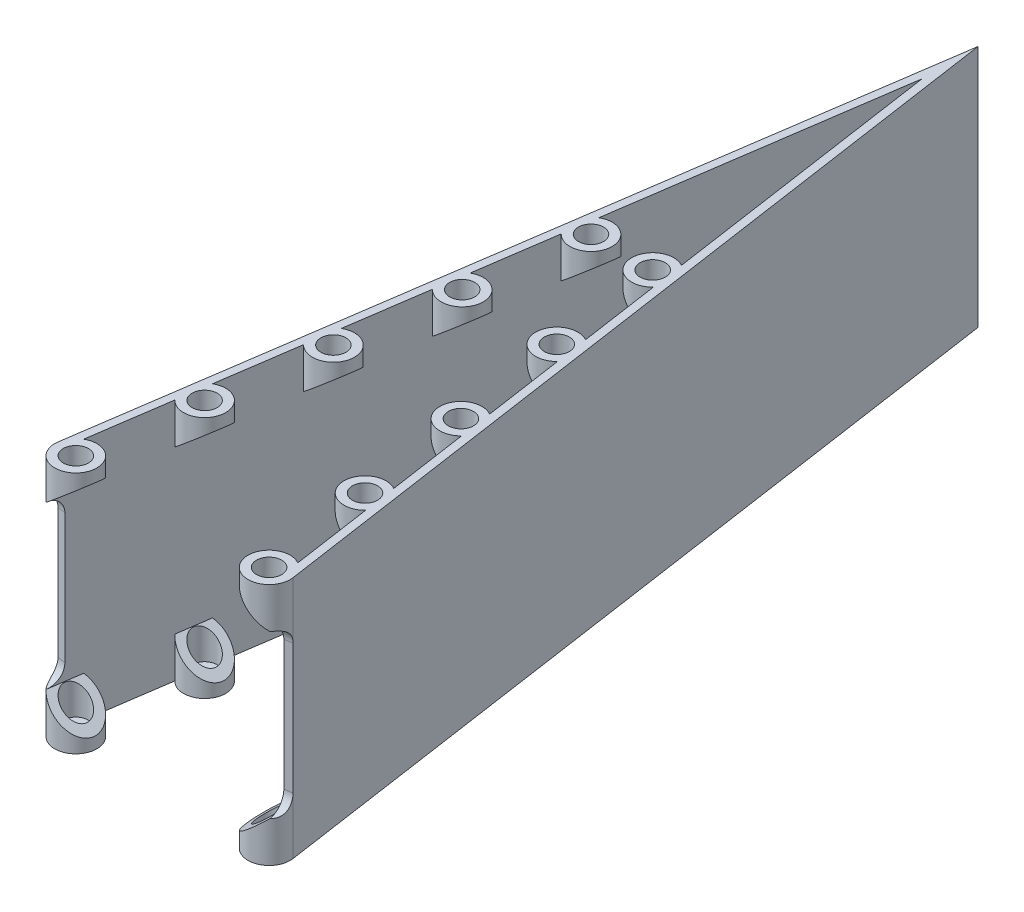
from build123d import *

# Parameters (mm, degrees)
BOSS_EXTRUDE1_DEPTH            = 30
SKETCH2_R                      = 2.6
SKETCH2_R_2                    = 1.55
BOSS_EXTRUDE3_DEPTH            = 5
CUT_EXTRUDE1_REACH             = 108.419
CUT_EXTRUDE1_DIRECTION_2_DEPTH = 107.419489108
CUT_EXTRUDE2_REACH             = 108.419
CUT_EXTRUDE2_DIRECTION_2_DEPTH = 107.419489108
FILLET1_R                      = 2
SKETCH6_R                      = 1.55
BOSS_EXTRUDE4_DEPTH            = 1


with BuildPart() as part:
    # Sketch1 → Boss-Extrude1 (new body)
    with BuildSketch(Plane(origin=(0, 0, 0), x_dir=(1, 0, 0), z_dir=(0, 1, 0))):
        Polygon((-13.5, 0), (0, 92.188031325), (13.5, 0), (14.489447114, 0.144894471), (0, 99.089605913), (-14.489447114, 0.144894471), align=None)
    extrude(amount=BOSS_EXTRUDE1_DEPTH)

    # Sketch2 → Boss-Extrude3 (add)
    # profile 1 of 10: a face of its own
    with BuildSketch(Plane(origin=(0, 0, 0), x_dir=(1, 0, 0), z_dir=(0, 1, 0))):
        with Locations((11.916884617, -0.231831154)):
            Circle(SKETCH2_R)
        with Locations(Location((11.916884617, -0.231831154, 0), (0, 0, 270))):
            Circle(SKETCH2_R_2, mode=Mode.SUBTRACT)
    # profile 2 of 10: a face of its own
    with BuildSketch(Plane(origin=(0, 0, 0), x_dir=(1, 0, 0), z_dir=(0, 1, 0))):
        with Locations((9.888362021, 13.620428448)):
            Circle(SKETCH2_R)
        with Locations(Location((9.888362021, 13.620428448, 0), (0, 0, 270))):
            Circle(SKETCH2_R_2, mode=Mode.SUBTRACT)
    # profile 3 of 10: a face of its own
    with BuildSketch(Plane(origin=(0, 0, 0), x_dir=(1, 0, 0), z_dir=(0, 1, 0))):
        with Locations((7.859839425, 27.47268805)):
            Circle(SKETCH2_R)
        with Locations(Location((7.859839425, 27.47268805, 0), (0, 0, 270))):
            Circle(SKETCH2_R_2, mode=Mode.SUBTRACT)
    # profile 4 of 10: a face of its own
    with BuildSketch(Plane(origin=(0, 0, 0), x_dir=(1, 0, 0), z_dir=(0, 1, 0))):
        with Locations((5.831316829, 41.324947652)):
            Circle(SKETCH2_R)
        with Locations(Location((5.831316829, 41.324947652, 0), (0, 0, 270))):
            Circle(SKETCH2_R_2, mode=Mode.SUBTRACT)
    # profile 5 of 10: a face of its own
    with BuildSketch(Plane(origin=(0, 0, 0), x_dir=(1, 0, 0), z_dir=(0, 1, 0))):
        with Locations((3.802794233, 55.177207254)):
            Circle(SKETCH2_R)
        with Locations(Location((3.802794233, 55.177207254, 0), (0, 0, 270))):
            Circle(SKETCH2_R_2, mode=Mode.SUBTRACT)
    # profile 6 of 10: a face of its own
    with BuildSketch(Plane(origin=(0, 0, 0), x_dir=(1, 0, 0), z_dir=(0, 1, 0))):
        with Locations((-11.916884617, -0.231831154)):
            Circle(SKETCH2_R)
        with Locations(Location((-11.916884617, -0.231831154, 0), (0, 0, 90))):
            Circle(SKETCH2_R_2, mode=Mode.SUBTRACT)
    # profile 7 of 10: a face of its own
    with BuildSketch(Plane(origin=(0, 0, 0), x_dir=(1, 0, 0), z_dir=(0, 1, 0))):
        with Locations((-9.888362021, 13.620428448)):
            Circle(SKETCH2_R)
        with Locations(Location((-9.888362021, 13.620428448, 0), (0, 0, 90))):
            Circle(SKETCH2_R_2, mode=Mode.SUBTRACT)
    # profile 8 of 10: a face of its own
    with BuildSketch(Plane(origin=(0, 0, 0), x_dir=(1, 0, 0), z_dir=(0, 1, 0))):
        with Locations((-7.859839425, 27.47268805)):
            Circle(SKETCH2_R)
        with Locations(Location((-7.859839425, 27.47268805, 0), (0, 0, 90))):
            Circle(SKETCH2_R_2, mode=Mode.SUBTRACT)
    # profile 9 of 10: a face of its own
    with BuildSketch(Plane(origin=(0, 0, 0), x_dir=(1, 0, 0), z_dir=(0, 1, 0))):
        with Locations((-5.831316829, 41.324947652)):
            Circle(SKETCH2_R)
        with Locations(Location((-5.831316829, 41.324947652, 0), (0, 0, 90))):
            Circle(SKETCH2_R_2, mode=Mode.SUBTRACT)
    # profile 10 of 10: a face of its own
    with BuildSketch(Plane(origin=(0, 0, 0), x_dir=(1, 0, 0), z_dir=(0, 1, 0))):
        with Locations((-3.802794233, 55.177207254)):
            Circle(SKETCH2_R)
        with Locations(Location((-3.802794233, 55.177207254, 0), (0, 0, 90))):
            Circle(SKETCH2_R_2, mode=Mode.SUBTRACT)
    boss_extrude3 = extrude(amount=BOSS_EXTRUDE3_DEPTH)

    # Cut-Extrude1: up to this face of the body (flat: up to its plane)
    cut_extrude1_end = Plane(part.part.faces().sort_by_distance((-6.674060715, 15.426495801, -46.612585527))[0])
    # Sketch4 → Cut-Extrude1 (cut, up to the picked face)
    with BuildSketch(Plane(origin=(0.283424505, 0, 1.935433121), x_dir=(0.9894471144188783, 0, -0.14489447114419254), z_dir=(0.14489447114419252, 0, 0.9894471144188782)), mode=Mode.PRIVATE) as cut_extrude1_sk1:
        Polygon((13.357536045, 5), (9.157536045, 5), (9.157536045, 1.475781549), align=None)
    cut_extrude1_tool1 = split(extrude(cut_extrude1_sk1.sketch, amount=-CUT_EXTRUDE1_REACH, mode=Mode.PRIVATE), bisect_by=cut_extrude1_end, keep=Keep.BOTH, mode=Mode.PRIVATE)
    cut_extrude1 = cut_extrude1_tool1.solids().sort_by(Axis((10.729548, 3.825261, 0.405705), (-0.14489447114419252, 0, -0.9894471144188782)))[0]
    add(cut_extrude1, mode=Mode.SUBTRACT)

    # Sketch4 → Cut-Extrude1 direction 2 (cut)
    with BuildSketch(Plane(origin=(0.283424505, 0, 1.935433121), x_dir=(0.9894471144188783, 0, -0.14489447114419254), z_dir=(0.14489447114419252, 0, 0.9894471144188782))):
        Polygon((13.357536045, 5), (9.157536045, 5), (9.157536045, 1.475781549), align=None)
    cut_extrude1_direction_2 = extrude(amount=CUT_EXTRUDE1_DIRECTION_2_DEPTH, mode=Mode.SUBTRACT)

    # Cut-Extrude2: up to this face of the body (flat: up to its plane)
    cut_extrude2_end = Plane(part.part.faces().sort_by_distance((6.674060715, 15.426495801, -46.612585527))[0])
    # Sketch5 → Cut-Extrude2 (cut, up to the picked face)
    with BuildSketch(Plane(origin=(-0.283424505, 0, 1.935433121), x_dir=(0.9894471144188784, 0, 0.14489447114419146), z_dir=(-0.14489447114419146, 0, 0.9894471144188784)), mode=Mode.PRIVATE) as cut_extrude2_sk1:
        Polygon((-9.157536045, 5), (-9.157536045, 1.475781549), (-13.357536045, 5), align=None)
    cut_extrude2_tool1 = split(extrude(cut_extrude2_sk1.sketch, amount=-CUT_EXTRUDE2_REACH, mode=Mode.PRIVATE), bisect_by=cut_extrude2_end, keep=Keep.BOTH, mode=Mode.PRIVATE)
    cut_extrude2 = cut_extrude2_tool1.solids().sort_by(Axis((-10.729548, 3.825261, 0.405705), (0.14489447114419146, 0, -0.9894471144188784)))[0]
    add(cut_extrude2, mode=Mode.SUBTRACT)

    # Sketch5 → Cut-Extrude2 direction 2 (cut)
    with BuildSketch(Plane(origin=(-0.283424505, 0, 1.935433121), x_dir=(0.9894471144188784, 0, 0.14489447114419146), z_dir=(-0.14489447114419146, 0, 0.9894471144188784))):
        Polygon((-9.157536045, 5), (-9.157536045, 1.475781549), (-13.357536045, 5), align=None)
    cut_extrude2_direction_2 = extrude(amount=CUT_EXTRUDE2_DIRECTION_2_DEPTH, mode=Mode.SUBTRACT)

    # Mirror2: Boss-Extrude3, Cut-Extrude1, Cut-Extrude1 direction 2, Cut-Extrude2, Cut-Extrude2 direction 2 across plane
    add(boss_extrude3.mirror(Plane.ZX.offset(15)))
    add(cut_extrude1.mirror(Plane.ZX.offset(15)), mode=Mode.SUBTRACT)
    add(cut_extrude1_direction_2.mirror(Plane.ZX.offset(15)), mode=Mode.SUBTRACT)
    add(cut_extrude2.mirror(Plane.ZX.offset(15)), mode=Mode.SUBTRACT)
    add(cut_extrude2_direction_2.mirror(Plane.ZX.offset(15)), mode=Mode.SUBTRACT)

    # Fillet1
    # the kernel refuses this fillet: 2 mm, written as the material it adds along each edge
    with BuildSketch(Plane(origin=(13.5, 5, 0), x_dir=(0, 1, 0), z_dir=(0.9894471144188783, 0, -0.1448944711441925))) as fillet1_piece_1_section:
        with BuildLine():
            CenterArc((FILLET1_R, FILLET1_R), FILLET1_R, 180, 90)
            Line((0, FILLET1_R), (0, 0))
            Line((0, 0), (FILLET1_R, 0))
        make_face()
    fillet1_piece_1 = extrude(amount=6, mode=Mode.PRIVATE)
    fillet1_piece_1 = fillet1_piece_1 & Plane(origin=(11.916884617, 5.699977741, 0.231831154), x_dir=(1, 0, 0), z_dir=(0, -1, 0)) * Cylinder(2.6, 20, mode=Mode.PRIVATE)
    add(fillet1_piece_1)
    with BuildSketch(Plane(origin=(13.5, 25, 0), x_dir=(0, -1, 0), z_dir=(0.9894471144188783, 0, -0.1448944711441925))) as fillet1_piece_2_section:
        with BuildLine():
            CenterArc((FILLET1_R, -FILLET1_R), FILLET1_R, 90, 90)
            Line((0, -FILLET1_R), (0, 0))
            Line((0, 0), (FILLET1_R, 0))
        make_face()
    fillet1_piece_2 = extrude(amount=6, mode=Mode.PRIVATE)
    fillet1_piece_2 = fillet1_piece_2 & Plane(origin=(11.916884617, 24.30002226, 0.231831154), x_dir=(1, 0, 0), z_dir=(0, 1, 0)) * Cylinder(2.6, 20, mode=Mode.PRIVATE)
    add(fillet1_piece_2)
    with BuildSketch(Plane(origin=(-19.436682687, 25, -0.869366827), x_dir=(0, -1, 0), z_dir=(0.9894471144188784, 0, 0.1448944711441914))) as fillet1_piece_3_section:
        with BuildLine():
            CenterArc((FILLET1_R, -FILLET1_R), FILLET1_R, 90, 90)
            Line((0, -FILLET1_R), (0, 0))
            Line((0, 0), (FILLET1_R, 0))
        make_face()
    fillet1_piece_3 = extrude(amount=6, mode=Mode.PRIVATE)
    fillet1_piece_3 = fillet1_piece_3 & Plane(origin=(-11.916884617, 24.777637105, 0.231831154), x_dir=(1, 0, 0), z_dir=(0, 1, 0)) * Cylinder(2.6, 21, mode=Mode.PRIVATE)
    add(fillet1_piece_3)
    with BuildSketch(Plane(origin=(-19.436682687, 5, -0.869366827), x_dir=(-0.1448944711441914, 0, 0.9894471144188784), z_dir=(0.9894471144188784, 0, 0.1448944711441914))) as fillet1_piece_4_section:
        with BuildLine():
            CenterArc((FILLET1_R, -FILLET1_R), FILLET1_R, 90, 90)
            Line((0, -FILLET1_R), (0, 0))
            Line((0, 0), (FILLET1_R, 0))
        make_face()
    fillet1_piece_4 = extrude(amount=6, mode=Mode.PRIVATE)
    fillet1_piece_4 = fillet1_piece_4 & Plane(origin=(-11.916884617, 5.222362792, 0.231831154), x_dir=(1, 0, 0), z_dir=(0, -1, 0)) * Cylinder(2.6, 21, mode=Mode.PRIVATE)
    add(fillet1_piece_4)

    # Sketch6 → Boss-Extrude4 (add)
    with BuildSketch(Plane.XZ):
        with Locations(Location((3.802794233, -55.177207254, 0), (0, 0, 270))):
            Circle(SKETCH6_R)
        with Locations(Location((-3.802794233, -55.177207254, 0), (0, 0, 270))):
            Circle(SKETCH6_R)
        with Locations(Location((-5.831316829, -41.324947652, 0), (0, 0, 270))):
            Circle(SKETCH6_R)
        with Locations(Location((5.831316829, -41.324947652, 0), (0, 0, 270))):
            Circle(SKETCH6_R)
        with Locations(Location((7.859839425, -27.47268805, 0), (0, 0, 270))):
            Circle(SKETCH6_R)
        with Locations(Location((-7.859839425, -27.47268805, 0), (0, 0, 270))):
            Circle(SKETCH6_R)
        with Locations(Location((-9.888362021, -13.620428448, 0), (0, 0, 270))):
            Circle(SKETCH6_R)
        with Locations(Location((9.888362021, -13.620428448, 0), (0, 0, 270))):
            Circle(SKETCH6_R)
        with Locations(Location((11.916884617, 0.231831154, 0), (0, 0, 270))):
            Circle(SKETCH6_R)
        with Locations(Location((-11.916884617, 0.231831154, 0), (0, 0, 270))):
            Circle(SKETCH6_R)
    extrude(amount=-BOSS_EXTRUDE4_DEPTH)


solid = part.part
